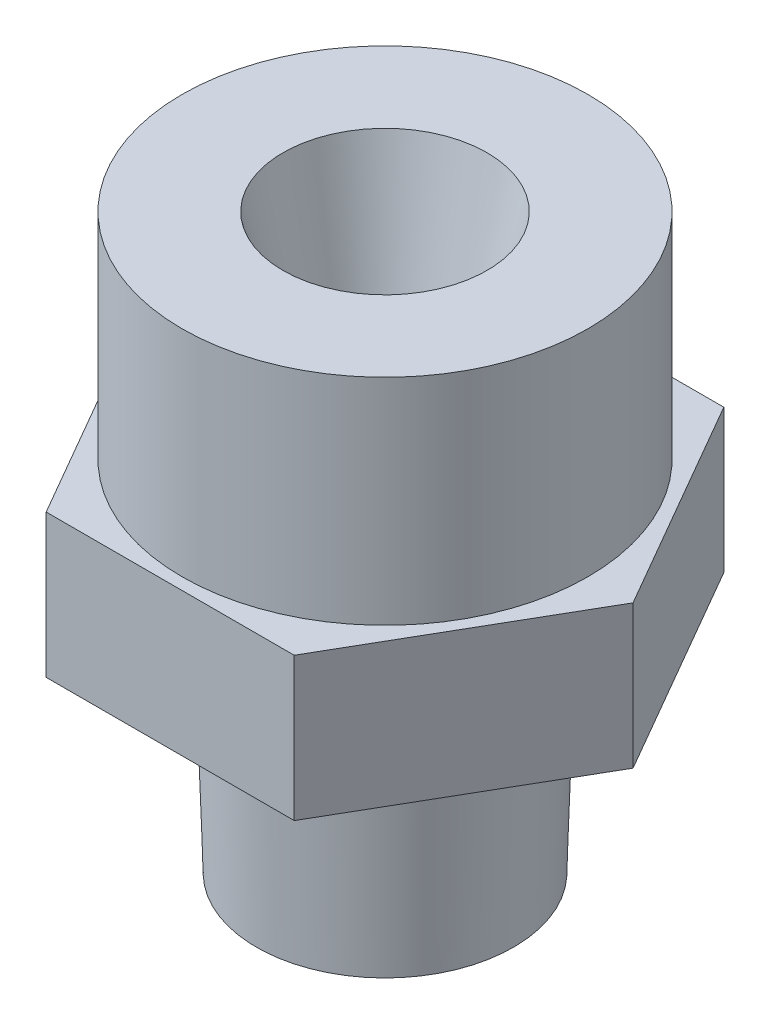
from build123d import *

# Parameters (mm, degrees)
SKETCH1_R           = 9
BOSS_EXTRUDE1_DEPTH = 9.525
SKETCH4_R           = 3.175
CUT_EXTRUDE1_DEPTH  = 3.175
SKETCH5_R           = 3.175
CUT_EXTRUDE2_DEPTH  = 15.224011389
CUT_EXTRUDE2_DRAFT  = 12
BOSS_EXTRUDE3_START = 6.35
SKETCH6_R           = 3.175
BOSS_EXTRUDE3_DEPTH = 6.35
SKETCH7_R           = 6
BOSS_EXTRUDE4_DEPTH = 9.525
BOSS_EXTRUDE4_TAPER = 1.79
SKETCH8_R           = 3.175
CUT_EXTRUDE3_DEPTH  = 30.272053652


with BuildPart() as part:
    # Sketch1 → Boss-Extrude1 (new body)
    with BuildSketch(Plane(origin=(0, 0, 0), x_dir=(1, 0, 0), z_dir=(0, 1, 0))):
        Circle(SKETCH1_R)
    extrude(amount=BOSS_EXTRUDE1_DEPTH)

    # Sketch4 → Cut-Extrude1 (cut)
    with BuildSketch(Plane.XZ):
        Circle(SKETCH4_R)
    extrude(amount=-CUT_EXTRUDE1_DEPTH, mode=Mode.SUBTRACT)


with BuildPart() as cut_extrude2_tool:
    # Sketch5 → Cut-Extrude2 (with draft: the straight prism first)
    with BuildSketch(Plane(origin=(0, 3.175, 0), x_dir=(-1, 0, 0), z_dir=(0, -1, 0))):
        Circle(SKETCH5_R)
    extrude(amount=-CUT_EXTRUDE2_DEPTH)
    # Cut-Extrude2: the draft: its side faces are tilted about the plane it starts from
    cut_extrude2_sides = [cut_extrude2_tool.faces().sort_by_distance(p)[0] for p in [
        (3.175, 10.787005695, 0),
    ]]
    draft(cut_extrude2_sides, Plane(origin=(0, 3.175, 0), x_dir=(-1, 0, 0), z_dir=(0, -1, 0)), CUT_EXTRUDE2_DRAFT)


with BuildPart() as part_1:
    add(part.part)

    # Cut-Extrude2: cut by cut_extrude2_tool
    add(cut_extrude2_tool.part, mode=Mode.SUBTRACT)

    # Sketch6 → Boss-Extrude3 (add)
    with BuildSketch(Plane.XZ.offset(BOSS_EXTRUDE3_START)):
        Polygon((-10.998522628, 0), (-5.499261314, -9.525), (5.499261314, -9.525), (10.998522628, 0), (5.499261314, 9.525), (-5.499261314, 9.525), align=None)
        Circle(SKETCH6_R, mode=Mode.SUBTRACT)
    extrude(amount=-BOSS_EXTRUDE3_DEPTH)

    # Sketch7 → Boss-Extrude4 (add)
    with BuildSketch(Plane.XZ.offset(6.35)):
        Circle(SKETCH7_R)
    extrude(amount=BOSS_EXTRUDE4_DEPTH, taper=BOSS_EXTRUDE4_TAPER)

    # Sketch8 → Cut-Extrude3 (cut, through all)
    with BuildSketch(Plane.XZ.offset(15.875)):
        Circle(SKETCH8_R)
    extrude(amount=-CUT_EXTRUDE3_DEPTH, mode=Mode.SUBTRACT)


solid = part_1.part
